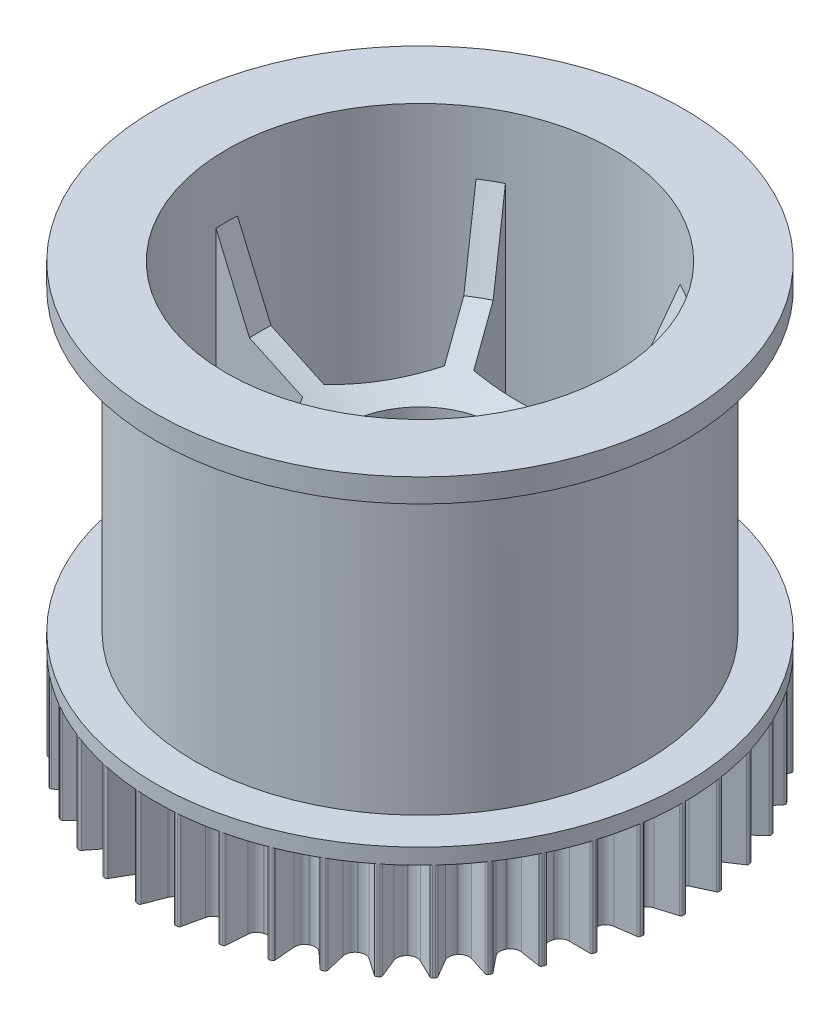
from build123d import *

# Parameters (mm, degrees)
SKETCH_1_R          = 3.9
EXTRUDE_1_DEPTH     = 5
SKETCH_2_R          = 13.5
SKETCH_2_R_2        = 11.2
EXTRUDE_2_DEPTH     = 0.8
SKETCH_2_2_R        = 11.5
SKETCH_2_2_R_2      = 10.9
EXTRUDE_2_2_DEPTH   = 16
SKETCH_5_R          = 13.5
SKETCH_5_R_2        = 10.9
EXTRUDE_3_DEPTH     = 1.2
SKETCH_6_R          = 3.9
EXTRUDE_5_DEPTH     = 8
SKETCH_8_R          = 3.9
SKETCH_8_R_2        = 3.4
EXTRUDE_6_DEPTH     = 13
SKETCH_8_2_R        = 3.9
SKETCH_8_2_R_2      = 3.4
CUT_EXTRUDE_1_DEPTH = 3
CUT_EXTRUDE_START   = -3
SKETCH_9_R          = 3.9
CUT_EXTRUDE_2_DEPTH = 3
EXTRUDE_8_REACH     = 31.28
SKETCH_10_R         = 11.5
SKETCH_10_R_2       = 9.9
CUT_EXTRUDE_START_2 = -22.2
CUT_EXTRUDE_3_DEPTH = 22.2


with BuildPart() as part:
    # 草图1 → 凸台-拉伸1 (new body)
    with BuildSketch(Plane(origin=(0, 0, 0), x_dir=(1, 0, 0), z_dir=(0, 1, 0))):
        with BuildLine():
            Line((12.421648835, 0.449416948), (13.428727986, 0.146279171))
            ThreePointArc((13.428727986, 0.146279171), (13.480048996, 0.110330314), (13.499904043, 0.050900158))
            ThreePointArc((13.499904043, 0.050900158), (13.5, 0), (13.499904043, -0.050900158))
            ThreePointArc((13.499904043, -0.050900158), (13.480048996, -0.110330314), (13.428727986, -0.146279171))
            Line((13.428727986, -0.146279171), (12.421648835, -0.449416948))
            ThreePointArc((12.421648835, -0.449416948), (12.175747513, -0.615329239), (12.067123529, -0.89136398))
            ThreePointArc((12.067123529, -0.89136398), (12.066165946, -0.904234132), (12.065194637, -0.917103256))
            ThreePointArc((12.065194637, -0.917103256), (12.131464538, -1.206244482), (12.349891401, -1.40695336))
            Line((12.349891401, -1.40695336), (13.300541969, -1.856802698))
            ThreePointArc((13.300541969, -1.856802698), (13.345931866, -1.899999035), (13.356707544, -1.961724646))
            ThreePointArc((13.356707544, -1.961724646), (13.349216154, -2.012070593), (13.341534994, -2.062387937))
            ThreePointArc((13.341534994, -2.062387937), (13.313044106, -2.118195066), (13.256938411, -2.146093404))
            Line((13.256938411, -2.146093404), (12.21592716, -2.295748024))
            ThreePointArc((12.21592716, -2.295748024), (11.948044409, -2.423157522), (11.799492821, -2.679919618))
            ThreePointArc((11.799492821, -2.679919618), (11.796627737, -2.692503301), (11.793749233, -2.705083921))
            ThreePointArc((11.793749233, -2.705083921), (11.816184691, -3.000872694), (12.0022578, -3.231894655))
            Line((12.0022578, -3.231894655), (12.875243823, -3.818406662))
            ThreePointArc((12.875243823, -3.818406662), (12.913688672, -3.867885545), (12.915144269, -3.930527764))
            ThreePointArc((12.915144269, -3.930527764), (12.900232878, -3.979194855), (12.885138099, -4.027805378))
            ThreePointArc((12.885138099, -4.027805378), (12.84864781, -4.07874284), (12.789010738, -4.097967457))
            Line((12.789010738, -4.097967457), (11.737321858, -4.090795883))
            ThreePointArc((11.737321858, -4.090795883), (11.453441736, -4.176856469), (11.268280943, -4.40861028))
            ThreePointArc((11.268280943, -4.40861028), (11.263572359, -4.420626395), (11.258850961, -4.432637481))
            ThreePointArc((11.258850961, -4.432637481), (11.236950804, -4.72846637), (11.386513594, -4.984640763))
            Line((11.386513594, -4.984640763), (12.162334005, -5.694713732))
            ThreePointArc((12.162334005, -5.694713732), (12.192975012, -5.749369884), (12.185078013, -5.811529386))
            ThreePointArc((12.185078013, -5.811529386), (12.163079717, -5.857430478), (12.140908512, -5.903248302))
            ThreePointArc((12.140908512, -5.903248302), (12.097233954, -5.94817824), (12.035397698, -5.958299689))
            Line((12.035397698, -5.958299689), (10.996524182, -5.794462121))
            ThreePointArc((10.996524182, -5.794462121), (10.702988102, -5.837251346), (10.485354288, -6.038819873))
            ThreePointArc((10.485354288, -6.038819873), (10.478907386, -6.05), (10.472448563, -6.061173244))
            ThreePointArc((10.472448563, -6.061173244), (10.406702004, -6.35043392), (10.51641349, -6.626038234))
            Line((10.51641349, -6.626038234), (11.177737743, -7.443810306))
            ThreePointArc((11.177737743, -7.443810306), (11.199890439, -7.5024228), (11.18281725, -7.562711045))
            ThreePointArc((11.18281725, -7.562711045), (11.154223453, -7.604820784), (11.12547109, -7.646822414))
            ThreePointArc((11.12547109, -7.646822414), (11.075587881, -7.684741166), (11.012933761, -7.685533352))
            Line((11.012933761, -7.685533352), (10.010082327, -7.368689651))
            ThreePointArc((10.010082327, -7.368689651), (9.713447399, -7.367251672), (9.468202145, -7.534132209))
            ThreePointArc((9.468202145, -7.534132209), (9.460160938, -7.544226602), (9.452108969, -7.554312413))
            ThreePointArc((9.452108969, -7.554312413), (9.343984679, -7.83054327), (9.411394086, -8.11942096))
            Line((9.411394086, -8.11942096), (9.943449291, -9.026624459))
            ThreePointArc((9.943449291, -9.026624459), (9.956618821, -9.087883988), (9.930750828, -9.144954237))
            ThreePointArc((9.930750828, -9.144954237), (9.89620027, -9.18233196), (9.861509029, -9.219579149))
            ThreePointArc((9.861509029, -9.219579149), (9.806531477, -9.249639674), (9.744459083, -9.241084899))
            Line((9.744459083, -9.241084899), (8.800031773, -8.778312831))
            ThreePointArc((8.800031773, -8.778312831), (8.506924332, -8.732679771), (8.239546012, -8.861144482))
            ThreePointArc((8.239546012, -8.861144482), (8.230090127, -8.869927649), (8.22062488, -8.878700726))
            ThreePointArc((8.22062488, -8.878700726), (8.072538176, -9.135731223), (8.09613969, -9.431429239))
            Line((8.09613969, -9.431429239), (8.487040612, -10.407798738))
            ThreePointArc((8.487040612, -10.407798738), (8.49093279, -10.470336865), (8.456847843, -10.522914262))
            ThreePointArc((8.456847843, -10.522914262), (8.417112325, -10.554725013), (8.377257151, -10.586385721))
            ThreePointArc((8.377257151, -10.586385721), (8.318413365, -10.607916516), (8.258309291, -10.59020588))
            Line((8.258309291, -10.59020588), (7.393403052, -9.991843007))
            ThreePointArc((7.393403052, -9.991843007), (7.110370633, -9.903034234), (6.826832036, -9.990213429))
            ThreePointArc((6.826832036, -9.990213429), (6.816172703, -9.997489169), (6.805505615, -10.004753536))
            ThreePointArc((6.805505615, -10.004753536), (6.620764509, -10.236842037), (6.600030911, -10.532754974))
            Line((6.600030911, -10.532754974), (6.841045471, -11.556479991))
            ThreePointArc((6.841045471, -11.556479991), (6.835573353, -11.618899718), (6.794032851, -11.665809771))
            ThreePointArc((6.794032851, -11.665809771), (6.75, -11.691342951), (6.705871192, -11.716709929))
            ThreePointArc((6.705871192, -11.716709929), (6.644475643, -11.729230032), (6.587682515, -11.702759162))
            Line((6.587682515, -11.702759162), (5.821617923, -10.982171922))
            ThreePointArc((5.821617923, -10.982171922), (5.554983004, -10.852171276), (5.261617913, -10.896117516))
            ThreePointArc((5.261617913, -10.896117516), (5.249993243, -10.901723302), (5.238362601, -10.907316685))
            ThreePointArc((5.238362601, -10.907316685), (5.021093904, -11.109278715), (4.956488349, -11.398796367))
            Line((4.956488349, -11.398796367), (5.042232678, -12.447008578))
            ThreePointArc((5.042232678, -12.447008578), (5.027518502, -12.507915551), (4.979450393, -12.548110367))
            ThreePointArc((4.979450393, -12.548110367), (4.932103829, -12.566795607), (4.884687151, -12.585302199))
            ThreePointArc((4.884687151, -12.585302199), (4.822111316, -12.588531931), (4.769897799, -12.553892142))
            Line((4.769897799, -12.553892142), (4.11978747, -11.727177263))
            ThreePointArc((4.11978747, -11.727177263), (3.875506233, -11.558888745), (3.578867941, -11.558620344))
            ThreePointArc((3.578867941, -11.558620344), (3.56653761, -11.56243095), (3.554203222, -11.566228402))
            ThreePointArc((3.554203222, -11.566228402), (3.309260359, -11.733552465), (3.202226027, -12.010207485))
            Line((3.202226027, -12.010207485), (3.13078474, -13.059491561))
            ThreePointArc((3.13078474, -13.059491561), (3.107157195, -13.117525219), (3.053635241, -13.150106913))
            ThreePointArc((3.053635241, -13.150106913), (3.004032608, -13.161526814), (2.954387271, -13.172759614))
            ThreePointArc((2.954387271, -13.172759614), (2.89202899, -13.166626828), (2.845561447, -13.124591917))
            Line((2.845561447, -13.124591917), (2.325927773, -12.210216843))
            ThreePointArc((2.325927773, -12.210216843), (2.109457058, -12.007399739), (1.816171974, -11.962922693))
            ThreePointArc((1.816171974, -11.962922693), (1.803411421, -11.964852997), (1.790648816, -11.96676969))
            ThreePointArc((1.790648816, -11.96676969), (1.523503405, -12.095718042), (1.376431267, -12.353330415))
            Line((1.376431267, -12.353330415), (1.149400244, -13.380247083))
            ThreePointArc((1.149400244, -13.380247083), (1.117387131, -13.43411105), (1.059606923, -13.4583518))
            ThreePointArc((1.059606923, -13.4583518), (1.008856263, -13.462251262), (0.958091262, -13.465959347))
            ThreePointArc((0.958091262, -13.465959347), (0.897343515, -13.45060104), (0.857659955, -13.402109995))
            Line((0.857659955, -13.402109995), (0.480110693, -12.420500356))
            ThreePointArc((0.480110693, -12.420500356), (0.296286097, -12.187685265), (0.012905725, -12.099993117))
            ThreePointArc((0.012905725, -12.099993117), (0, -12.1), (-0.012905725, -12.099993117))
            ThreePointArc((-0.012905725, -12.099993117), (-0.296286097, -12.187685265), (-0.480110693, -12.420500356))
            Line((-0.480110693, -12.420500356), (-0.857659955, -13.402109995))
            ThreePointArc((-0.857659955, -13.402109995), (-0.897343515, -13.45060104), (-0.958091262, -13.465959347))
            ThreePointArc((-0.958091262, -13.465959347), (-1.008856263, -13.462251262), (-1.059606923, -13.4583518))
            ThreePointArc((-1.059606923, -13.4583518), (-1.117387131, -13.43411105), (-1.149400244, -13.380247083))
            Line((-1.149400244, -13.380247083), (-1.376431267, -12.353330415))
            ThreePointArc((-1.376431267, -12.353330415), (-1.523503405, -12.095718042), (-1.790648816, -11.96676969))
            ThreePointArc((-1.790648816, -11.96676969), (-1.803411421, -11.964852997), (-1.816171974, -11.962922693))
            ThreePointArc((-1.816171974, -11.962922693), (-2.109457058, -12.007399739), (-2.325927773, -12.210216843))
            Line((-2.325927773, -12.210216843), (-2.845561447, -13.124591917))
            ThreePointArc((-2.845561447, -13.124591917), (-2.89202899, -13.166626828), (-2.954387271, -13.172759614))
            ThreePointArc((-2.954387271, -13.172759614), (-3.004032608, -13.161526814), (-3.053635241, -13.150106913))
            ThreePointArc((-3.053635241, -13.150106913), (-3.107157195, -13.117525219), (-3.13078474, -13.059491561))
            Line((-3.13078474, -13.059491561), (-3.202226027, -12.010207485))
            ThreePointArc((-3.202226027, -12.010207485), (-3.309260359, -11.733552465), (-3.554203222, -11.566228402))
            ThreePointArc((-3.554203222, -11.566228402), (-3.56653761, -11.56243095), (-3.578867941, -11.558620344))
            ThreePointArc((-3.578867941, -11.558620344), (-3.875506233, -11.558888745), (-4.11978747, -11.727177263))
            Line((-4.11978747, -11.727177263), (-4.769897799, -12.553892142))
            ThreePointArc((-4.769897799, -12.553892142), (-4.822111316, -12.588531931), (-4.884687151, -12.585302199))
            ThreePointArc((-4.884687151, -12.585302199), (-4.932103829, -12.566795607), (-4.979450393, -12.548110367))
            ThreePointArc((-4.979450393, -12.548110367), (-5.027518502, -12.507915551), (-5.042232678, -12.447008578))
            Line((-5.042232678, -12.447008578), (-4.956488349, -11.398796367))
            ThreePointArc((-4.956488349, -11.398796367), (-5.021093904, -11.109278715), (-5.238362601, -10.907316685))
            ThreePointArc((-5.238362601, -10.907316685), (-5.249993243, -10.901723302), (-5.261617913, -10.896117516))
            ThreePointArc((-5.261617913, -10.896117516), (-5.554983004, -10.852171276), (-5.821617923, -10.982171922))
            Line((-5.821617923, -10.982171922), (-6.587682515, -11.702759162))
            ThreePointArc((-6.587682515, -11.702759162), (-6.644475643, -11.729230032), (-6.705871192, -11.716709929))
            ThreePointArc((-6.705871192, -11.716709929), (-6.75, -11.691342951), (-6.794032851, -11.665809771))
            ThreePointArc((-6.794032851, -11.665809771), (-6.835573353, -11.618899718), (-6.841045471, -11.556479991))
            Line((-6.841045471, -11.556479991), (-6.600030911, -10.532754974))
            ThreePointArc((-6.600030911, -10.532754974), (-6.620764509, -10.236842037), (-6.805505615, -10.004753536))
            ThreePointArc((-6.805505615, -10.004753536), (-6.816172703, -9.997489169), (-6.826832036, -9.990213429))
            ThreePointArc((-6.826832036, -9.990213429), (-7.110370633, -9.903034234), (-7.393403052, -9.991843007))
            Line((-7.393403052, -9.991843007), (-8.258309291, -10.59020588))
            ThreePointArc((-8.258309291, -10.59020588), (-8.318413365, -10.607916516), (-8.377257151, -10.586385721))
            ThreePointArc((-8.377257151, -10.586385721), (-8.417112325, -10.554725013), (-8.456847843, -10.522914262))
            ThreePointArc((-8.456847843, -10.522914262), (-8.49093279, -10.470336865), (-8.487040612, -10.407798738))
            Line((-8.487040612, -10.407798738), (-8.09613969, -9.431429239))
            ThreePointArc((-8.09613969, -9.431429239), (-8.072538176, -9.135731223), (-8.22062488, -8.878700726))
            ThreePointArc((-8.22062488, -8.878700726), (-8.230090127, -8.869927649), (-8.239546012, -8.861144482))
            ThreePointArc((-8.239546012, -8.861144482), (-8.506924332, -8.732679771), (-8.800031773, -8.778312831))
            Line((-8.800031773, -8.778312831), (-9.744459083, -9.241084899))
            ThreePointArc((-9.744459083, -9.241084899), (-9.806531477, -9.249639674), (-9.861509029, -9.219579149))
            ThreePointArc((-9.861509029, -9.219579149), (-9.89620027, -9.18233196), (-9.930750828, -9.144954237))
            ThreePointArc((-9.930750828, -9.144954237), (-9.956618821, -9.087883988), (-9.943449291, -9.026624459))
            Line((-9.943449291, -9.026624459), (-9.411394086, -8.11942096))
            ThreePointArc((-9.411394086, -8.11942096), (-9.343984679, -7.83054327), (-9.452108969, -7.554312413))
            ThreePointArc((-9.452108969, -7.554312413), (-9.460160938, -7.544226602), (-9.468202145, -7.534132209))
            ThreePointArc((-9.468202145, -7.534132209), (-9.713447399, -7.367251672), (-10.010082327, -7.368689651))
            Line((-10.010082327, -7.368689651), (-11.012933761, -7.685533352))
            ThreePointArc((-11.012933761, -7.685533352), (-11.075587881, -7.684741166), (-11.12547109, -7.646822414))
            ThreePointArc((-11.12547109, -7.646822414), (-11.154223453, -7.604820784), (-11.18281725, -7.562711045))
            ThreePointArc((-11.18281725, -7.562711045), (-11.199890439, -7.5024228), (-11.177737743, -7.443810306))
            Line((-11.177737743, -7.443810306), (-10.51641349, -6.626038234))
            ThreePointArc((-10.51641349, -6.626038234), (-10.406702004, -6.35043392), (-10.472448563, -6.061173244))
            ThreePointArc((-10.472448563, -6.061173244), (-10.478907386, -6.05), (-10.485354288, -6.038819873))
            ThreePointArc((-10.485354288, -6.038819873), (-10.702988102, -5.837251346), (-10.996524182, -5.794462121))
            Line((-10.996524182, -5.794462121), (-12.035397698, -5.958299689))
            ThreePointArc((-12.035397698, -5.958299689), (-12.097233954, -5.94817824), (-12.140908512, -5.903248302))
            ThreePointArc((-12.140908512, -5.903248302), (-12.163079717, -5.857430478), (-12.185078013, -5.811529386))
            ThreePointArc((-12.185078013, -5.811529386), (-12.192975012, -5.749369884), (-12.162334005, -5.694713732))
            Line((-12.162334005, -5.694713732), (-11.386513594, -4.984640763))
            ThreePointArc((-11.386513594, -4.984640763), (-11.236950804, -4.72846637), (-11.258850961, -4.432637481))
            ThreePointArc((-11.258850961, -4.432637481), (-11.263572359, -4.420626395), (-11.268280943, -4.40861028))
            ThreePointArc((-11.268280943, -4.40861028), (-11.453441736, -4.176856469), (-11.737321858, -4.090795883))
            Line((-11.737321858, -4.090795883), (-12.789010738, -4.097967457))
            ThreePointArc((-12.789010738, -4.097967457), (-12.84864781, -4.07874284), (-12.885138099, -4.027805378))
            ThreePointArc((-12.885138099, -4.027805378), (-12.900232878, -3.979194855), (-12.915144269, -3.930527764))
            ThreePointArc((-12.915144269, -3.930527764), (-12.913688672, -3.867885545), (-12.875243823, -3.818406662))
            Line((-12.875243823, -3.818406662), (-12.0022578, -3.231894655))
            ThreePointArc((-12.0022578, -3.231894655), (-11.816184691, -3.000872694), (-11.793749233, -2.705083921))
            ThreePointArc((-11.793749233, -2.705083921), (-11.796627737, -2.692503301), (-11.799492821, -2.679919618))
            ThreePointArc((-11.799492821, -2.679919618), (-11.948044409, -2.423157522), (-12.21592716, -2.295748024))
            Line((-12.21592716, -2.295748024), (-13.256938411, -2.146093404))
            ThreePointArc((-13.256938411, -2.146093404), (-13.313044106, -2.118195066), (-13.341534994, -2.062387937))
            ThreePointArc((-13.341534994, -2.062387937), (-13.349216154, -2.012070593), (-13.356707544, -1.961724646))
            ThreePointArc((-13.356707544, -1.961724646), (-13.345931866, -1.899999035), (-13.300541969, -1.856802698))
            Line((-13.300541969, -1.856802698), (-12.349891401, -1.40695336))
            ThreePointArc((-12.349891401, -1.40695336), (-12.131464538, -1.206244482), (-12.065194637, -0.917103256))
            ThreePointArc((-12.065194637, -0.917103256), (-12.066165946, -0.904234132), (-12.067123529, -0.89136398))
            ThreePointArc((-12.067123529, -0.89136398), (-12.175747513, -0.615329239), (-12.421648835, -0.449416948))
            Line((-12.421648835, -0.449416948), (-13.428727986, -0.146279171))
            ThreePointArc((-13.428727986, -0.146279171), (-13.480048996, -0.110330314), (-13.499904043, -0.050900158))
            ThreePointArc((-13.499904043, -0.050900158), (-13.5, 0), (-13.499904043, 0.050900158))
            ThreePointArc((-13.499904043, 0.050900158), (-13.480048996, 0.110330314), (-13.428727986, 0.146279171))
            Line((-13.428727986, 0.146279171), (-12.421648835, 0.449416948))
            ThreePointArc((-12.421648835, 0.449416948), (-12.175747513, 0.615329239), (-12.067123529, 0.89136398))
            ThreePointArc((-12.067123529, 0.89136398), (-12.066165946, 0.904234132), (-12.065194637, 0.917103256))
            ThreePointArc((-12.065194637, 0.917103256), (-12.131464538, 1.206244482), (-12.349891401, 1.40695336))
            Line((-12.349891401, 1.40695336), (-13.300541969, 1.856802698))
            ThreePointArc((-13.300541969, 1.856802698), (-13.345931866, 1.899999035), (-13.356707544, 1.961724646))
            ThreePointArc((-13.356707544, 1.961724646), (-13.349216154, 2.012070593), (-13.341534994, 2.062387937))
            ThreePointArc((-13.341534994, 2.062387937), (-13.313044106, 2.118195066), (-13.256938411, 2.146093404))
            Line((-13.256938411, 2.146093404), (-12.21592716, 2.295748024))
            ThreePointArc((-12.21592716, 2.295748024), (-11.948044409, 2.423157522), (-11.799492821, 2.679919618))
            ThreePointArc((-11.799492821, 2.679919618), (-11.796627737, 2.692503301), (-11.793749233, 2.705083921))
            ThreePointArc((-11.793749233, 2.705083921), (-11.816184691, 3.000872694), (-12.0022578, 3.231894655))
            Line((-12.0022578, 3.231894655), (-12.875243823, 3.818406662))
            ThreePointArc((-12.875243823, 3.818406662), (-12.913688672, 3.867885545), (-12.915144269, 3.930527764))
            ThreePointArc((-12.915144269, 3.930527764), (-12.900232878, 3.979194855), (-12.885138099, 4.027805378))
            ThreePointArc((-12.885138099, 4.027805378), (-12.84864781, 4.07874284), (-12.789010738, 4.097967457))
            Line((-12.789010738, 4.097967457), (-11.737321858, 4.090795883))
            ThreePointArc((-11.737321858, 4.090795883), (-11.453441736, 4.176856469), (-11.268280943, 4.40861028))
            ThreePointArc((-11.268280943, 4.40861028), (-11.263572359, 4.420626395), (-11.258850961, 4.432637481))
            ThreePointArc((-11.258850961, 4.432637481), (-11.236950804, 4.72846637), (-11.386513594, 4.984640763))
            Line((-11.386513594, 4.984640763), (-12.162334005, 5.694713732))
            ThreePointArc((-12.162334005, 5.694713732), (-12.192975012, 5.749369884), (-12.185078013, 5.811529386))
            ThreePointArc((-12.185078013, 5.811529386), (-12.163079717, 5.857430478), (-12.140908512, 5.903248302))
            ThreePointArc((-12.140908512, 5.903248302), (-12.097233954, 5.94817824), (-12.035397698, 5.958299689))
            Line((-12.035397698, 5.958299689), (-10.996524182, 5.794462121))
            ThreePointArc((-10.996524182, 5.794462121), (-10.702988102, 5.837251346), (-10.485354288, 6.038819873))
            ThreePointArc((-10.485354288, 6.038819873), (-10.478907386, 6.05), (-10.472448563, 6.061173244))
            ThreePointArc((-10.472448563, 6.061173244), (-10.406702004, 6.35043392), (-10.51641349, 6.626038234))
            Line((-10.51641349, 6.626038234), (-11.177737743, 7.443810306))
            ThreePointArc((-11.177737743, 7.443810306), (-11.199890439, 7.5024228), (-11.18281725, 7.562711045))
            ThreePointArc((-11.18281725, 7.562711045), (-11.154223453, 7.604820784), (-11.12547109, 7.646822414))
            ThreePointArc((-11.12547109, 7.646822414), (-11.075587881, 7.684741166), (-11.012933761, 7.685533352))
            Line((-11.012933761, 7.685533352), (-10.010082327, 7.368689651))
            ThreePointArc((-10.010082327, 7.368689651), (-9.713447399, 7.367251672), (-9.468202145, 7.534132209))
            ThreePointArc((-9.468202145, 7.534132209), (-9.460160938, 7.544226602), (-9.452108969, 7.554312413))
            ThreePointArc((-9.452108969, 7.554312413), (-9.343984679, 7.83054327), (-9.411394086, 8.11942096))
            Line((-9.411394086, 8.11942096), (-9.943449291, 9.026624459))
            ThreePointArc((-9.943449291, 9.026624459), (-9.956618821, 9.087883988), (-9.930750828, 9.144954237))
            ThreePointArc((-9.930750828, 9.144954237), (-9.89620027, 9.18233196), (-9.861509029, 9.219579149))
            ThreePointArc((-9.861509029, 9.219579149), (-9.806531477, 9.249639674), (-9.744459083, 9.241084899))
            Line((-9.744459083, 9.241084899), (-8.800031773, 8.778312831))
            ThreePointArc((-8.800031773, 8.778312831), (-8.506924332, 8.732679771), (-8.239546012, 8.861144482))
            ThreePointArc((-8.239546012, 8.861144482), (-8.230090127, 8.869927649), (-8.22062488, 8.878700726))
            ThreePointArc((-8.22062488, 8.878700726), (-8.072538176, 9.135731223), (-8.09613969, 9.431429239))
            Line((-8.09613969, 9.431429239), (-8.487040612, 10.407798738))
            ThreePointArc((-8.487040612, 10.407798738), (-8.49093279, 10.470336865), (-8.456847843, 10.522914262))
            ThreePointArc((-8.456847843, 10.522914262), (-8.417112325, 10.554725013), (-8.377257151, 10.586385721))
            ThreePointArc((-8.377257151, 10.586385721), (-8.318413365, 10.607916516), (-8.258309291, 10.59020588))
            Line((-8.258309291, 10.59020588), (-7.393403052, 9.991843007))
            ThreePointArc((-7.393403052, 9.991843007), (-7.110370633, 9.903034234), (-6.826832036, 9.990213429))
            ThreePointArc((-6.826832036, 9.990213429), (-6.816172703, 9.997489169), (-6.805505615, 10.004753536))
            ThreePointArc((-6.805505615, 10.004753536), (-6.620764509, 10.236842037), (-6.600030911, 10.532754974))
            Line((-6.600030911, 10.532754974), (-6.841045471, 11.556479991))
            ThreePointArc((-6.841045471, 11.556479991), (-6.835573353, 11.618899718), (-6.794032851, 11.665809771))
            ThreePointArc((-6.794032851, 11.665809771), (-6.75, 11.691342951), (-6.705871192, 11.716709929))
            ThreePointArc((-6.705871192, 11.716709929), (-6.644475643, 11.729230032), (-6.587682515, 11.702759162))
            Line((-6.587682515, 11.702759162), (-5.821617923, 10.982171922))
            ThreePointArc((-5.821617923, 10.982171922), (-5.554983004, 10.852171276), (-5.261617913, 10.896117516))
            ThreePointArc((-5.261617913, 10.896117516), (-5.249993243, 10.901723302), (-5.238362601, 10.907316685))
            ThreePointArc((-5.238362601, 10.907316685), (-5.021093904, 11.109278715), (-4.956488349, 11.398796367))
            Line((-4.956488349, 11.398796367), (-5.042232678, 12.447008578))
            ThreePointArc((-5.042232678, 12.447008578), (-5.027518502, 12.507915551), (-4.979450393, 12.548110367))
            ThreePointArc((-4.979450393, 12.548110367), (-4.932103829, 12.566795607), (-4.884687151, 12.585302199))
            ThreePointArc((-4.884687151, 12.585302199), (-4.822111316, 12.588531931), (-4.769897799, 12.553892142))
            Line((-4.769897799, 12.553892142), (-4.11978747, 11.727177263))
            ThreePointArc((-4.11978747, 11.727177263), (-3.875506233, 11.558888745), (-3.578867941, 11.558620344))
            ThreePointArc((-3.578867941, 11.558620344), (-3.56653761, 11.56243095), (-3.554203222, 11.566228402))
            ThreePointArc((-3.554203222, 11.566228402), (-3.309260359, 11.733552465), (-3.202226027, 12.010207485))
            Line((-3.202226027, 12.010207485), (-3.13078474, 13.059491561))
            ThreePointArc((-3.13078474, 13.059491561), (-3.107157195, 13.117525219), (-3.053635241, 13.150106913))
            ThreePointArc((-3.053635241, 13.150106913), (-3.004032608, 13.161526814), (-2.954387271, 13.172759614))
            ThreePointArc((-2.954387271, 13.172759614), (-2.89202899, 13.166626828), (-2.845561447, 13.124591917))
            Line((-2.845561447, 13.124591917), (-2.325927773, 12.210216843))
            ThreePointArc((-2.325927773, 12.210216843), (-2.109457058, 12.007399739), (-1.816171974, 11.962922693))
            ThreePointArc((-1.816171974, 11.962922693), (-1.803411421, 11.964852997), (-1.790648816, 11.96676969))
            ThreePointArc((-1.790648816, 11.96676969), (-1.523503405, 12.095718042), (-1.376431267, 12.353330415))
            Line((-1.376431267, 12.353330415), (-1.149400244, 13.380247083))
            ThreePointArc((-1.149400244, 13.380247083), (-1.117387131, 13.43411105), (-1.059606923, 13.4583518))
            ThreePointArc((-1.059606923, 13.4583518), (-1.008856263, 13.462251262), (-0.958091262, 13.465959347))
            ThreePointArc((-0.958091262, 13.465959347), (-0.897343515, 13.45060104), (-0.857659955, 13.402109995))
            Line((-0.857659955, 13.402109995), (-0.480110693, 12.420500356))
            ThreePointArc((-0.480110693, 12.420500356), (-0.296286097, 12.187685265), (-0.012905725, 12.099993117))
            ThreePointArc((-0.012905725, 12.099993117), (0, 12.1), (0.012905725, 12.099993117))
            ThreePointArc((0.012905725, 12.099993117), (0.296286097, 12.187685265), (0.480110693, 12.420500356))
            Line((0.480110693, 12.420500356), (0.857659955, 13.402109995))
            ThreePointArc((0.857659955, 13.402109995), (0.897343515, 13.45060104), (0.958091262, 13.465959347))
            ThreePointArc((0.958091262, 13.465959347), (1.008856263, 13.462251262), (1.059606923, 13.4583518))
            ThreePointArc((1.059606923, 13.4583518), (1.117387131, 13.43411105), (1.149400244, 13.380247083))
            Line((1.149400244, 13.380247083), (1.376431267, 12.353330415))
            ThreePointArc((1.376431267, 12.353330415), (1.523503405, 12.095718042), (1.790648816, 11.96676969))
            ThreePointArc((1.790648816, 11.96676969), (1.803411421, 11.964852997), (1.816171974, 11.962922693))
            ThreePointArc((1.816171974, 11.962922693), (2.109457058, 12.007399739), (2.325927773, 12.210216843))
            Line((2.325927773, 12.210216843), (2.845561447, 13.124591917))
            ThreePointArc((2.845561447, 13.124591917), (2.89202899, 13.166626828), (2.954387271, 13.172759614))
            ThreePointArc((2.954387271, 13.172759614), (3.004032608, 13.161526814), (3.053635241, 13.150106913))
            ThreePointArc((3.053635241, 13.150106913), (3.107157195, 13.117525219), (3.13078474, 13.059491561))
            Line((3.13078474, 13.059491561), (3.202226027, 12.010207485))
            ThreePointArc((3.202226027, 12.010207485), (3.309260359, 11.733552465), (3.554203222, 11.566228402))
            ThreePointArc((3.554203222, 11.566228402), (3.56653761, 11.56243095), (3.578867941, 11.558620344))
            ThreePointArc((3.578867941, 11.558620344), (3.875506233, 11.558888745), (4.11978747, 11.727177263))
            Line((4.11978747, 11.727177263), (4.769897799, 12.553892142))
            ThreePointArc((4.769897799, 12.553892142), (4.822111316, 12.588531931), (4.884687151, 12.585302199))
            ThreePointArc((4.884687151, 12.585302199), (4.932103829, 12.566795607), (4.979450393, 12.548110367))
            ThreePointArc((4.979450393, 12.548110367), (5.027518502, 12.507915551), (5.042232678, 12.447008578))
            Line((5.042232678, 12.447008578), (4.956488349, 11.398796367))
            ThreePointArc((4.956488349, 11.398796367), (5.021093904, 11.109278715), (5.238362601, 10.907316685))
            ThreePointArc((5.238362601, 10.907316685), (5.249993243, 10.901723302), (5.261617913, 10.896117516))
            ThreePointArc((5.261617913, 10.896117516), (5.554983004, 10.852171276), (5.821617923, 10.982171922))
            Line((5.821617923, 10.982171922), (6.587682515, 11.702759162))
            ThreePointArc((6.587682515, 11.702759162), (6.644475643, 11.729230032), (6.705871192, 11.716709929))
            ThreePointArc((6.705871192, 11.716709929), (6.75, 11.691342951), (6.794032851, 11.665809771))
            ThreePointArc((6.794032851, 11.665809771), (6.835573353, 11.618899718), (6.841045471, 11.556479991))
            Line((6.841045471, 11.556479991), (6.600030911, 10.532754974))
            ThreePointArc((6.600030911, 10.532754974), (6.620764509, 10.236842037), (6.805505615, 10.004753536))
            ThreePointArc((6.805505615, 10.004753536), (6.816172703, 9.997489169), (6.826832036, 9.990213429))
            ThreePointArc((6.826832036, 9.990213429), (7.110370633, 9.903034234), (7.393403052, 9.991843007))
            Line((7.393403052, 9.991843007), (8.258309291, 10.59020588))
            ThreePointArc((8.258309291, 10.59020588), (8.318413365, 10.607916516), (8.377257151, 10.586385721))
            ThreePointArc((8.377257151, 10.586385721), (8.417112325, 10.554725013), (8.456847843, 10.522914262))
            ThreePointArc((8.456847843, 10.522914262), (8.49093279, 10.470336865), (8.487040612, 10.407798738))
            Line((8.487040612, 10.407798738), (8.09613969, 9.431429239))
            ThreePointArc((8.09613969, 9.431429239), (8.072538176, 9.135731223), (8.22062488, 8.878700726))
            ThreePointArc((8.22062488, 8.878700726), (8.230090127, 8.869927649), (8.239546012, 8.861144482))
            ThreePointArc((8.239546012, 8.861144482), (8.506924332, 8.732679771), (8.800031773, 8.778312831))
            Line((8.800031773, 8.778312831), (9.744459083, 9.241084899))
            ThreePointArc((9.744459083, 9.241084899), (9.806531477, 9.249639674), (9.861509029, 9.219579149))
            ThreePointArc((9.861509029, 9.219579149), (9.89620027, 9.18233196), (9.930750828, 9.144954237))
            ThreePointArc((9.930750828, 9.144954237), (9.956618821, 9.087883988), (9.943449291, 9.026624459))
            Line((9.943449291, 9.026624459), (9.411394086, 8.11942096))
            ThreePointArc((9.411394086, 8.11942096), (9.343984679, 7.83054327), (9.452108969, 7.554312413))
            ThreePointArc((9.452108969, 7.554312413), (9.460160938, 7.544226602), (9.468202145, 7.534132209))
            ThreePointArc((9.468202145, 7.534132209), (9.713447399, 7.367251672), (10.010082327, 7.368689651))
            Line((10.010082327, 7.368689651), (11.012933761, 7.685533352))
            ThreePointArc((11.012933761, 7.685533352), (11.075587881, 7.684741166), (11.12547109, 7.646822414))
            ThreePointArc((11.12547109, 7.646822414), (11.154223453, 7.604820784), (11.18281725, 7.562711045))
            ThreePointArc((11.18281725, 7.562711045), (11.199890439, 7.5024228), (11.177737743, 7.443810306))
            Line((11.177737743, 7.443810306), (10.51641349, 6.626038234))
            ThreePointArc((10.51641349, 6.626038234), (10.406702004, 6.35043392), (10.472448563, 6.061173244))
            ThreePointArc((10.472448563, 6.061173244), (10.478907386, 6.05), (10.485354288, 6.038819873))
            ThreePointArc((10.485354288, 6.038819873), (10.702988102, 5.837251346), (10.996524182, 5.794462121))
            Line((10.996524182, 5.794462121), (12.035397698, 5.958299689))
            ThreePointArc((12.035397698, 5.958299689), (12.097233954, 5.94817824), (12.140908512, 5.903248302))
            ThreePointArc((12.140908512, 5.903248302), (12.163079717, 5.857430478), (12.185078013, 5.811529386))
            ThreePointArc((12.185078013, 5.811529386), (12.192975012, 5.749369884), (12.162334005, 5.694713732))
            Line((12.162334005, 5.694713732), (11.386513594, 4.984640763))
            ThreePointArc((11.386513594, 4.984640763), (11.236950804, 4.72846637), (11.258850961, 4.432637481))
            ThreePointArc((11.258850961, 4.432637481), (11.263572359, 4.420626395), (11.268280943, 4.40861028))
            ThreePointArc((11.268280943, 4.40861028), (11.453441736, 4.176856469), (11.737321858, 4.090795883))
            Line((11.737321858, 4.090795883), (12.789010738, 4.097967457))
            ThreePointArc((12.789010738, 4.097967457), (12.84864781, 4.07874284), (12.885138099, 4.027805378))
            ThreePointArc((12.885138099, 4.027805378), (12.900232878, 3.979194855), (12.915144269, 3.930527764))
            ThreePointArc((12.915144269, 3.930527764), (12.913688672, 3.867885545), (12.875243823, 3.818406662))
            Line((12.875243823, 3.818406662), (12.0022578, 3.231894655))
            ThreePointArc((12.0022578, 3.231894655), (11.816184691, 3.000872694), (11.793749233, 2.705083921))
            ThreePointArc((11.793749233, 2.705083921), (11.796627737, 2.692503301), (11.799492821, 2.679919618))
            ThreePointArc((11.799492821, 2.679919618), (11.948044409, 2.423157522), (12.21592716, 2.295748024))
            Line((12.21592716, 2.295748024), (13.256938411, 2.146093404))
            ThreePointArc((13.256938411, 2.146093404), (13.313044106, 2.118195066), (13.341534994, 2.062387937))
            ThreePointArc((13.341534994, 2.062387937), (13.349216154, 2.012070593), (13.356707544, 1.961724646))
            ThreePointArc((13.356707544, 1.961724646), (13.345931866, 1.899999035), (13.300541969, 1.856802698))
            Line((13.300541969, 1.856802698), (12.349891401, 1.40695336))
            ThreePointArc((12.349891401, 1.40695336), (12.131464538, 1.206244482), (12.065194637, 0.917103256))
            ThreePointArc((12.065194637, 0.917103256), (12.066165946, 0.904234132), (12.067123529, 0.89136398))
            ThreePointArc((12.067123529, 0.89136398), (12.175747513, 0.615329239), (12.421648835, 0.449416948))
        make_face()
        with Locations(Location((0, 0, 0), (0, 0, 270))):
            Circle(SKETCH_1_R, mode=Mode.SUBTRACT)
        with BuildLine():
            Line((3.204293994, -4.45), (5.455960044, -0.55))
            Line((5.455960044, -0.55), (11.186487384, -0.55))
            ThreePointArc((11.186487384, -0.55), (9.699484522, -5.6), (6.069557664, -9.412782254))
            Line((6.069557664, -9.412782254), (3.204293994, -4.45))
        make_face(mode=Mode.SUBTRACT)
        with BuildLine():
            Line((2.25166605, -5), (-2.25166605, -5))
            Line((-2.25166605, -5), (-5.11692972, -9.962782254))
            ThreePointArc((-5.11692972, -9.962782254), (0, -11.2), (5.11692972, -9.962782254))
            Line((5.11692972, -9.962782254), (2.25166605, -5))
        make_face(mode=Mode.SUBTRACT)
        with BuildLine():
            Line((-3.204293994, -4.45), (-5.455960044, -0.55))
            Line((-5.455960044, -0.55), (-11.186487384, -0.55))
            ThreePointArc((-11.186487384, -0.55), (-9.699484522, -5.6), (-6.069557664, -9.412782254))
            Line((-6.069557664, -9.412782254), (-3.204293994, -4.45))
        make_face(mode=Mode.SUBTRACT)
        with BuildLine():
            Line((5.455960044, 0.55), (11.186487384, 0.55))
            ThreePointArc((11.186487384, 0.55), (9.699484522, 5.6), (6.069557664, 9.412782254))
            Line((6.069557664, 9.412782254), (3.204293994, 4.45))
            Line((3.204293994, 4.45), (5.455960044, 0.55))
        make_face(mode=Mode.SUBTRACT)
        with BuildLine():
            Line((-5.455960044, 0.55), (-11.186487384, 0.55))
            ThreePointArc((-11.186487384, 0.55), (-9.699484522, 5.6), (-6.069557664, 9.412782254))
            Line((-6.069557664, 9.412782254), (-3.204293994, 4.45))
            Line((-3.204293994, 4.45), (-5.455960044, 0.55))
        make_face(mode=Mode.SUBTRACT)
        with BuildLine():
            Line((-2.25166605, 5), (-5.11692972, 9.962782254))
            ThreePointArc((-5.11692972, 9.962782254), (0, 11.2), (5.11692972, 9.962782254))
            Line((5.11692972, 9.962782254), (2.25166605, 5))
            Line((2.25166605, 5), (-2.25166605, 5))
        make_face(mode=Mode.SUBTRACT)
    extrude(amount=EXTRUDE_1_DEPTH)

    # 草图2 → Extrude 2 (add)
    with BuildSketch(Plane(origin=(0, 5, 0), x_dir=(1, 0, 0), z_dir=(0, 1, 0))):
        with Locations(Location((0, 0, 0), (0, 0, 94.069686794))):
            Circle(SKETCH_2_R)
        with Locations(Location((0, 0, 0), (0, 0, 117.18523589))):
            Circle(SKETCH_2_R_2, mode=Mode.SUBTRACT)
    extrude(amount=EXTRUDE_2_DEPTH)

    # 草图2<2> → Extrude 2 2 (add)
    with BuildSketch(Plane(origin=(0, 5, 0), x_dir=(1, 0, 0), z_dir=(0, 1, 0))):
        Circle(SKETCH_2_2_R)
        Circle(SKETCH_2_2_R_2, mode=Mode.SUBTRACT)
    extrude(amount=EXTRUDE_2_2_DEPTH)

    # 草图5 → 凸台-拉伸3 (add)
    with BuildSketch(Plane(origin=(0, 21, 0), x_dir=(1, 0, 0), z_dir=(0, 1, 0))):
        with Locations(Location((0, 0, 0), (0, 0, 94.069686794))):
            Circle(SKETCH_5_R)
        with Locations(Location((0, 0, 0), (0, 0, 117.107700331))):
            Circle(SKETCH_5_R_2, mode=Mode.SUBTRACT)
    extrude(amount=EXTRUDE_3_DEPTH)

    # 草图6 → 凸台-拉伸5 (add)
    with BuildSketch(Plane(origin=(0, 5, 0), x_dir=(1, 0, 0), z_dir=(0, 1, 0))):
        with BuildLine():
            Line((-4.966743533, -9.702652147), (-2.25166605, -5))
            Line((-2.25166605, -5), (2.25166605, -5))
            Line((2.25166605, -5), (4.966743533, -9.702652147))
            ThreePointArc((4.966743533, -9.702652147), (5.45, -9.439676901), (5.919371477, -9.152652147))
            Line((5.919371477, -9.152652147), (3.204293994, -4.45))
            Line((3.204293994, -4.45), (5.455960044, -0.55))
            Line((5.455960044, -0.55), (10.886115009, -0.55))
            ThreePointArc((10.886115009, -0.55), (10.9, 0), (10.886115009, 0.55))
            Line((10.886115009, 0.55), (5.455960044, 0.55))
            Line((5.455960044, 0.55), (3.204293994, 4.45))
            Line((3.204293994, 4.45), (5.919371477, 9.152652147))
            ThreePointArc((5.919371477, 9.152652147), (5.45, 9.439676901), (4.966743533, 9.702652147))
            Line((4.966743533, 9.702652147), (2.25166605, 5))
            Line((2.25166605, 5), (-2.25166605, 5))
            Line((-2.25166605, 5), (-4.966743533, 9.702652147))
            ThreePointArc((-4.966743533, 9.702652147), (-5.45, 9.439676901), (-5.919371477, 9.152652147))
            Line((-5.919371477, 9.152652147), (-3.204293994, 4.45))
            Line((-3.204293994, 4.45), (-5.455960044, 0.55))
            Line((-5.455960044, 0.55), (-10.886115009, 0.55))
            ThreePointArc((-10.886115009, 0.55), (-10.9, 0), (-10.886115009, -0.55))
            Line((-10.886115009, -0.55), (-5.455960044, -0.55))
            Line((-5.455960044, -0.55), (-3.204293994, -4.45))
            Line((-3.204293994, -4.45), (-5.919371477, -9.152652147))
            ThreePointArc((-5.919371477, -9.152652147), (-5.45, -9.439676901), (-4.966743533, -9.702652147))
        make_face()
        with Locations(Location((0, 0, 0), (0, 0, 270))):
            Circle(SKETCH_6_R, mode=Mode.SUBTRACT)
    extrude(amount=EXTRUDE_5_DEPTH)

    # 草图8 → 凸台-拉伸6 (add)
    with BuildSketch(Plane.XZ):
        Circle(SKETCH_8_R)
        with Locations(Location((0, 0, 0), (0, 0, 270))):
            Circle(SKETCH_8_R_2, mode=Mode.SUBTRACT)
    extrude(amount=-EXTRUDE_6_DEPTH)

    # 草图8<2> → 切除-拉伸1 (cut)
    with BuildSketch(Plane.XZ):
        with Locations(Location((0, 0, 0), (0, 0, 270))):
            Circle(SKETCH_8_2_R)
        with Locations(Location((0, 0, 0), (0, 0, 270))):
            Circle(SKETCH_8_2_R_2, mode=Mode.SUBTRACT)
    extrude(amount=-CUT_EXTRUDE_1_DEPTH, mode=Mode.SUBTRACT)

    # 草图9 → 切除-拉伸2 (cut)
    with BuildSketch(Plane(origin=(0, 13, 0), x_dir=(1, 0, 0), z_dir=(0, 1, 0)).offset(CUT_EXTRUDE_START)):
        with Locations(Location((0, 0, 0), (0, 0, 90))):
            Circle(SKETCH_9_R)
    extrude(amount=CUT_EXTRUDE_2_DEPTH, mode=Mode.SUBTRACT)

    # 凸台-拉伸8: up to this face of the body (flat: up to its plane)
    extrude_8_end = Plane(part.part.faces().sort_by_distance((13.009713737, 0, -2.079979342))[0])
    # 草图10 → 凸台-拉伸8 (add, up to the picked face)
    with BuildSketch(Plane(origin=(0, 22.2, 0), x_dir=(1, 0, 0), z_dir=(0, 1, 0)), mode=Mode.PRIVATE) as extrude_8_sk1:
        Circle(SKETCH_10_R)
        with Locations(Location((0, 0, 0), (0, 0, 270))):
            Circle(SKETCH_10_R_2, mode=Mode.SUBTRACT)
    extrude_8_tool1 = split(extrude(extrude_8_sk1.sketch, amount=-EXTRUDE_8_REACH, mode=Mode.PRIVATE), bisect_by=extrude_8_end, keep=Keep.BOTH, mode=Mode.PRIVATE)
    add(extrude_8_tool1.solids().sort_by(Axis((-11.174731, 22.2, 0), (0, -1, 0)))[0])

    # 草图12 → 旋转4 (revolve)
    with BuildSketch(Plane.XY, mode=Mode.PRIVATE) as revolve_4_sk:
        Polygon((-3.9, 13), (-9.9, 13), (-9.9, 19), (-8.189013841, 15), align=None)
    revolve(revolve_4_sk.sketch.rotate(Axis((0, 0, 0), (0, 1, 0)), 90), axis=Axis((0, 0, 0), (0, 1, 0)))

    # 草图13 → 切除-拉伸3 (cut)
    with BuildSketch(Plane.XZ.offset(CUT_EXTRUDE_START_2)):
        with BuildLine():
            Line((-3.204293994, 4.45), (-5.41866918, 8.285410329))
            ThreePointArc((-5.41866918, 8.285410329), (-8.573651497, 4.95), (-9.884710416, 0.55))
            Line((-9.884710416, 0.55), (-5.455960044, 0.55))
            Line((-5.455960044, 0.55), (-3.204293994, 4.45))
        make_face()
        with BuildLine():
            Line((2.25166605, 5), (4.466041236, 8.835410329))
            ThreePointArc((4.466041236, 8.835410329), (0, 9.9), (-4.466041236, 8.835410329))
            Line((-4.466041236, 8.835410329), (-2.25166605, 5))
            Line((-2.25166605, 5), (2.25166605, 5))
        make_face()
        with BuildLine():
            Line((5.455960044, 0.55), (9.884710416, 0.55))
            ThreePointArc((9.884710416, 0.55), (8.573651497, 4.95), (5.41866918, 8.285410329))
            Line((5.41866918, 8.285410329), (3.204293994, 4.45))
            Line((3.204293994, 4.45), (5.455960044, 0.55))
        make_face()
        with BuildLine():
            Line((3.204293994, -4.45), (5.41866918, -8.285410329))
            ThreePointArc((5.41866918, -8.285410329), (8.573651497, -4.95), (9.884710416, -0.55))
            Line((9.884710416, -0.55), (5.455960044, -0.55))
            Line((5.455960044, -0.55), (3.204293994, -4.45))
        make_face()
        with BuildLine():
            Line((-2.25166605, -5), (-4.466041236, -8.835410329))
            ThreePointArc((-4.466041236, -8.835410329), (0, -9.9), (4.466041236, -8.835410329))
            Line((4.466041236, -8.835410329), (2.25166605, -5))
            Line((2.25166605, -5), (-2.25166605, -5))
        make_face()
        with BuildLine():
            Line((-5.455960044, -0.55), (-9.884710416, -0.55))
            ThreePointArc((-9.884710416, -0.55), (-8.573651497, -4.95), (-5.41866918, -8.285410329))
            Line((-5.41866918, -8.285410329), (-3.204293994, -4.45))
            Line((-3.204293994, -4.45), (-5.455960044, -0.55))
        make_face()
    extrude(amount=CUT_EXTRUDE_3_DEPTH, mode=Mode.SUBTRACT)


solid = part.part
